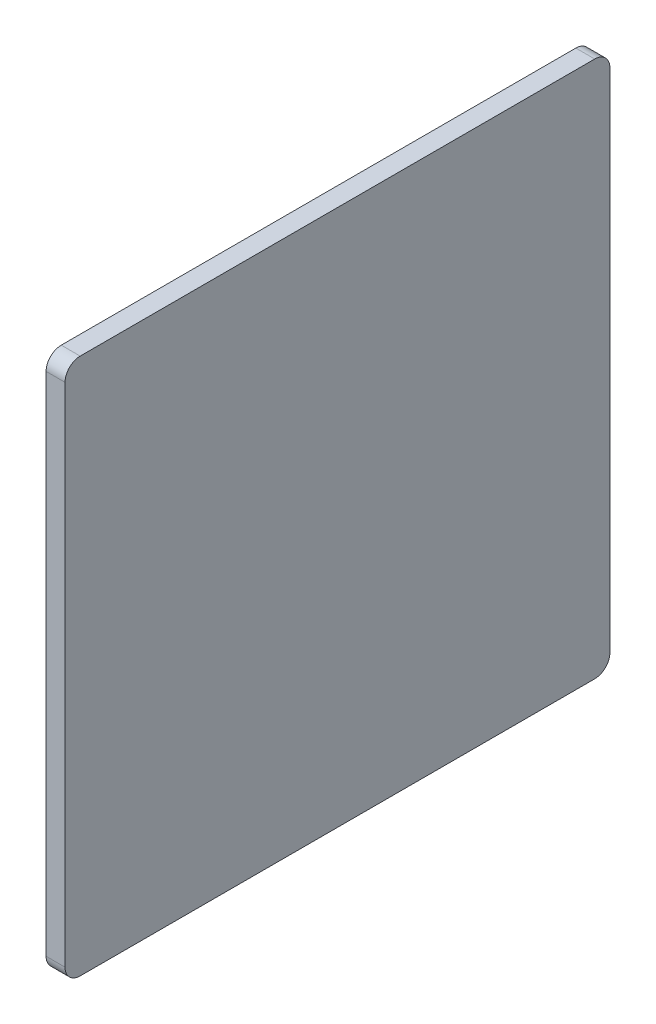
from build123d import *

# Parameters (mm, degrees)
SKETCH1_W           = 91.35
SKETCH1_H           = 90
BOSS_EXTRUDE1_DEPTH = 3.175
FILLET1_R           = 2.54


with BuildPart() as part:
    # Sketch1 → Boss-Extrude1 (new body)
    with BuildSketch(Plane(origin=(0, 0, 0), x_dir=(0, 0, -1), z_dir=(1, 0, 0))):
        Rectangle(SKETCH1_W, SKETCH1_H)
    extrude(amount=BOSS_EXTRUDE1_DEPTH)

    # Fillet1
    fillet1_edges = [part.edges().sort_by_distance(p)[0] for p in [
        (1.5875, -45, 45.675),
        (1.5875, -45, -45.675),
        (1.5875, 45, -45.675),
        (1.5875, 45, 45.675),
    ]]
    fillet(fillet1_edges, radius=FILLET1_R)


solid = part.part
